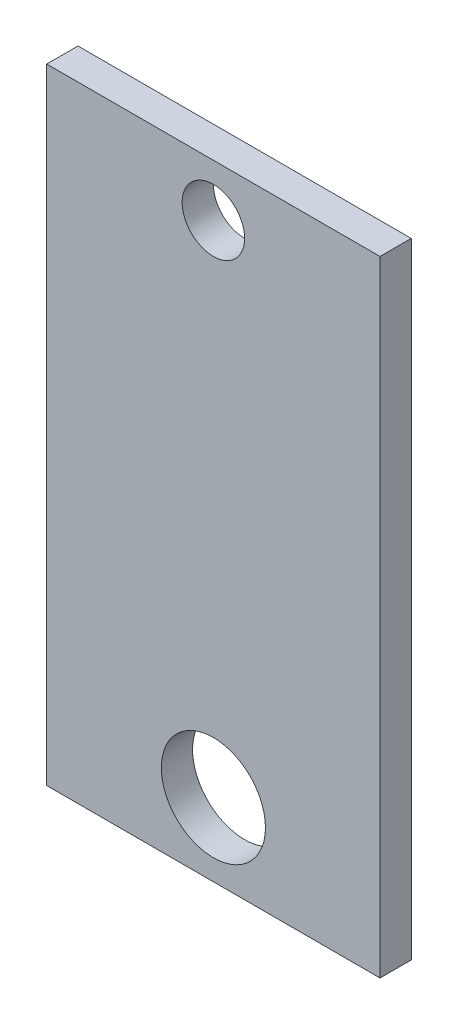
from build123d import *

# Parameters (mm, degrees)
SKETCH_1_W          = 16
SKETCH_1_H          = 30
EXTRUDE_1_DEPTH     = 1.5
SKETCH_2_R          = 1.5
SKETCH_2_R_2        = 2.5
CUT_EXTRUDE_1_DEPTH = 35.03307215


with BuildPart() as part:
    # Эскиз1 → Бобышка-Вытянуть1 (new body)
    with BuildSketch(Plane.XY):
        with Locations((8, 15)):
            Rectangle(SKETCH_1_W, SKETCH_1_H)
    extrude(amount=EXTRUDE_1_DEPTH)

    # Эскиз2 → Вырез-Вытянуть1 (cut, through all)
    with BuildSketch(Plane.XY.offset(1.5)):
        with Locations((8, 27.5)):
            Circle(SKETCH_2_R)
        with Locations((8, 3.5)):
            Circle(SKETCH_2_R_2)
    extrude(amount=-CUT_EXTRUDE_1_DEPTH, mode=Mode.SUBTRACT)


solid = part.part
